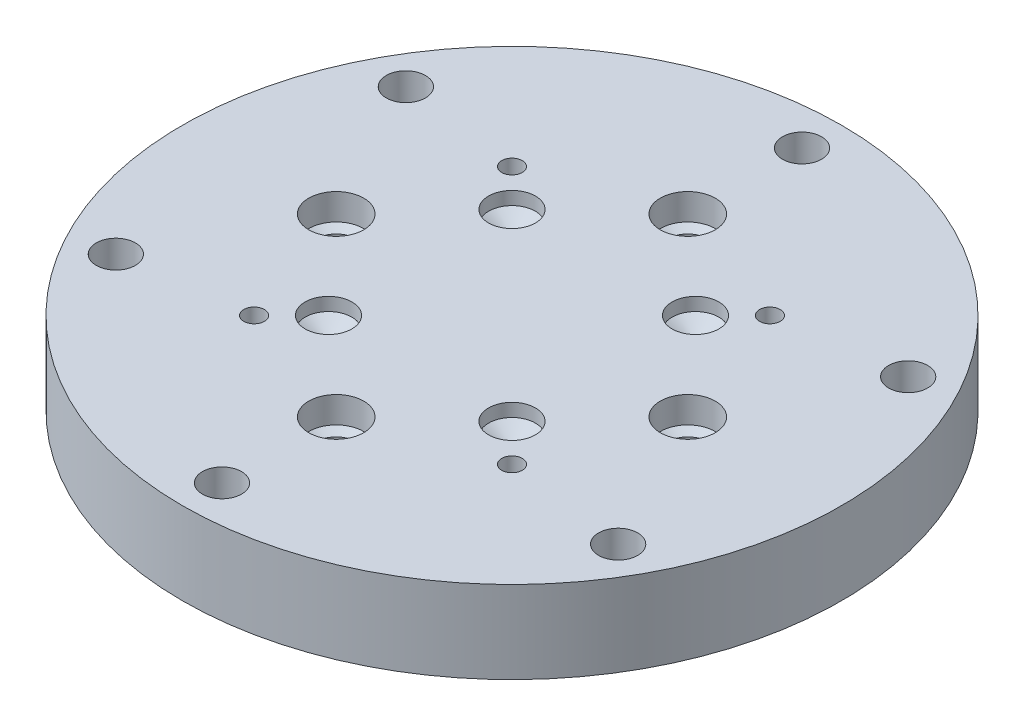
from build123d import *

# Parameters (mm, degrees)
OUTER_R                     = 19.05
BODY_DEPTH                  = 4.7625
F_4_40_TAPPED_HOLE_D        = 2.2606
SCREW_HOLES_COUNT           = 6
F_0_80_TAPPED_HOLE_D        = 1.19126
INNER_SCREW_HOLES_COUNT     = 4
F_43_0_089_DIAMETER_HOLE1_D = 2.2606
IO_HOLES_PATTERN_COUNT      = 4
POST_BOTTOMS_COUNT          = 4


with BuildPart() as part:
    # outer → Body (new body)
    with BuildSketch(Plane(origin=(0, 0, 0), x_dir=(1, 0, 0), z_dir=(0, 1, 0))):
        Circle(OUTER_R)
    extrude(amount=-BODY_DEPTH)

    # #4-40 Tapped Hole (through all)
    with Locations(Plane(origin=(0, 0, 0), x_dir=(1, 0, 0), z_dir=(0, 1, 0))):
        with Locations((0, -16.764)):
            f_4_40_tapped_hole = Hole(F_4_40_TAPPED_HOLE_D / 2)

    # Screw Holes: #4-40 Tapped Hole ×6 about axis
    screw_holes_axis = Axis((0, 0.15875, 0), (0, -1, 0))
    for i in range(1, SCREW_HOLES_COUNT):
        add(f_4_40_tapped_hole.rotate(screw_holes_axis, i * 360 / SCREW_HOLES_COUNT), mode=Mode.SUBTRACT)

    # #0-80 Tapped Hole (through all)
    with Locations(Plane(origin=(0, 0, 0), x_dir=(1, 0, 0), z_dir=(0, 1, 0))):
        with Locations((-7.45361258, 7.45361258)):
            f_0_80_tapped_hole = Hole(F_0_80_TAPPED_HOLE_D / 2)

    # Inner Screw Holes: #0-80 Tapped Hole ×4 about axis
    inner_screw_holes_axis = Axis((0, 0.15875, 0), (0, -1, 0))
    for i in range(1, INNER_SCREW_HOLES_COUNT):
        add(f_0_80_tapped_hole.rotate(inner_screw_holes_axis, i * 360 / INNER_SCREW_HOLES_COUNT), mode=Mode.SUBTRACT)

    # #43 (0.089) Diameter Hole1 (through all)
    with Locations(Plane(origin=(0, 0, 0), x_dir=(1, 0, 0), z_dir=(0, 1, 0))):
        with Locations((0, 10.16)):
            f_43_0_089_diameter_hole1 = Hole(F_43_0_089_DIAMETER_HOLE1_D / 2)

    # Sketch40 → 1/8 (0.125) Diameter Hole1 (revolve, cut)
    with BuildSketch(Plane(origin=(0, 0, -10.16), x_dir=(0, 0, 1), z_dir=(1, 0, 0))):
        Polygon((0, 0), (0, 2.477866233), (1.5875, 1.524), (1.5875, 0), align=None)
    f_1_8_0_125_diameter_hole1 = revolve(axis=Axis((0, 6.35, -10.16), (0, -1, 0)), mode=Mode.SUBTRACT)

    # Sketch42 → 1/8 (0.125) Diameter Hole2 (revolve, cut)
    with BuildSketch(Plane(origin=(0, -4.7625, -10.16), x_dir=(0, 0, -1), z_dir=(1, 0, 0))):
        Polygon((0, 0), (0, 2.477866233), (1.5875, 1.524), (1.5875, 0), align=None)
    f_1_8_0_125_diameter_hole2 = revolve(axis=Axis((0, -11.1125, -10.16), (0, 1, 0)), mode=Mode.SUBTRACT)

    # IO Holes Pattern: #43 (0.089) Diameter Hole1, 1/8 (0.125) Diameter Hole1, 1/8 (0.125) Diameter Hole2 ×4 about axis
    io_holes_pattern_axis = Axis((0, 0.15875, 0), (0, -1, 0))
    add([f_43_0_089_diameter_hole1.rotate(io_holes_pattern_axis, i * 360 / IO_HOLES_PATTERN_COUNT) for i in range(1, IO_HOLES_PATTERN_COUNT)], mode=Mode.SUBTRACT)
    add([f_1_8_0_125_diameter_hole1.rotate(io_holes_pattern_axis, i * 360 / IO_HOLES_PATTERN_COUNT) for i in range(1, IO_HOLES_PATTERN_COUNT)], mode=Mode.SUBTRACT)
    add([f_1_8_0_125_diameter_hole2.rotate(io_holes_pattern_axis, i * 360 / IO_HOLES_PATTERN_COUNT) for i in range(1, IO_HOLES_PATTERN_COUNT)], mode=Mode.SUBTRACT)

    # Sketch45 → #36 (0.1065) Diameter Hole1 (revolve, cut)
    with BuildSketch(Plane(origin=(-5.303300849, 0, -5.303300849), x_dir=(0, 0, 1), z_dir=(1, 0, 0))):
        Polygon((0, 0), (0, 1.57469403), (1.35255, 0.762), (1.35255, 0), align=None)
    f_36_0_1065_diameter_hole1 = revolve(axis=Axis((-5.303300849, 6.35, -5.303300849), (0, -1, 0)), mode=Mode.SUBTRACT)

    # Post Bottoms: #36 (0.1065) Diameter Hole1 ×4 about axis
    post_bottoms_axis = Axis((0, 0.15875, 0), (0, -1, 0))
    for i in range(1, POST_BOTTOMS_COUNT):
        add(f_36_0_1065_diameter_hole1.rotate(post_bottoms_axis, i * 360 / POST_BOTTOMS_COUNT), mode=Mode.SUBTRACT)


solid = part.part
